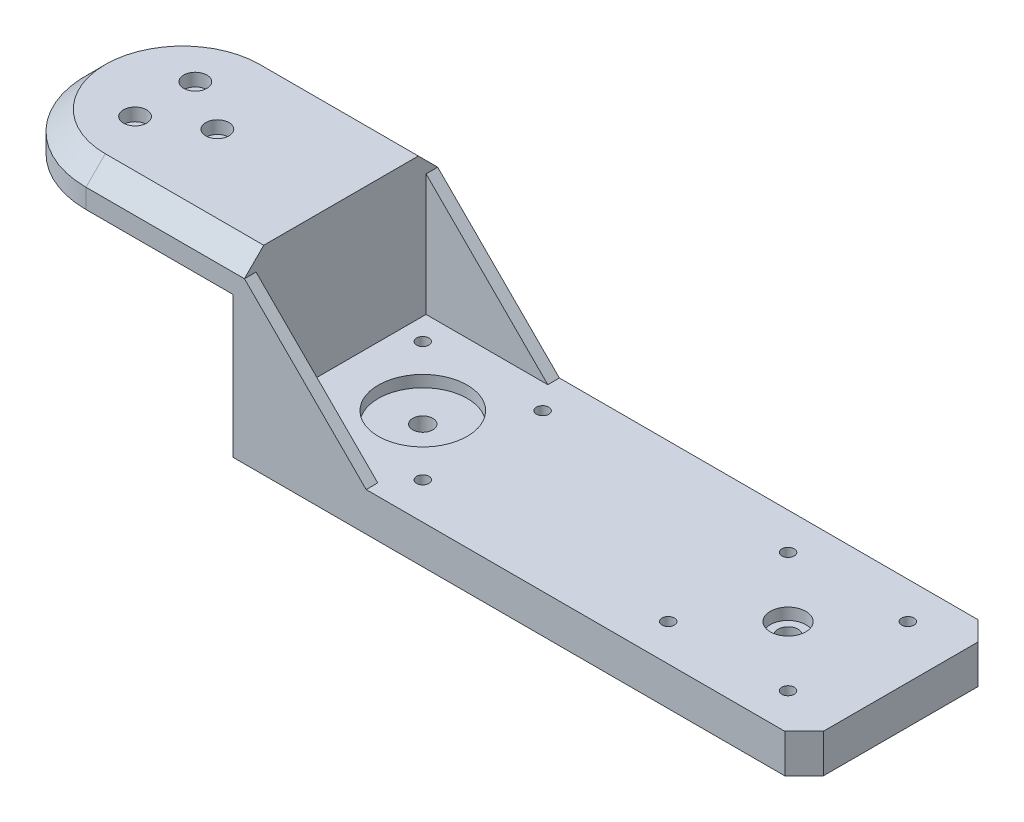
from build123d import *

# Parameters (mm, degrees)
SKETCH_1_R          = 12.4
SKETCH_1_R_2        = 1.6
EXTRUDE_1_DEPTH     = 19.5
EXTRUDE_START       = -10
SKETCH_4_R          = 12.4
EXTRUDE_3_DEPTH     = 10
SKETCH_5_W          = 50
SKETCH_5_H          = 36.5
EXTRUDE_4_DEPTH     = 8
SKETCH_6_W          = 152.81
SKETCH_6_H          = 50
SKETCH_6_R          = 2.6
SKETCH_6_R_2        = 1.6
EXTRUDE_5_DEPTH     = 10
SKETCH_7_R          = 4.6
CUT_EXTRUDE_1_DEPTH = 3
CHAMFER_2_SIZE      = 5
EXTRUDE_6_DEPTH     = 3
EXTRUDE_7_DEPTH     = 3
CHAMFER_3_SIZE      = 5
CHAMFER_4_SIZE      = 5
SKETCH_13_R         = 11.5
CUT_EXTRUDE_3_DEPTH = 3
CHAMFER_6_SIZE      = 1
SKETCH_18_R         = 3
CUT_EXTRUDE_6_DEPTH = 3.3


with BuildPart() as part:
    # 草图1 → 凸台-拉伸1 (new body)
    with BuildSketch(Plane(origin=(0, 0, 0), x_dir=(1, 0, 0), z_dir=(0, 1, 0))):
        Circle(SKETCH_1_R)
        with Locations((9, 0)):
            Circle(SKETCH_1_R_2, mode=Mode.SUBTRACT)
        with Locations((-4.5, -7.794228634)):
            Circle(SKETCH_1_R_2, mode=Mode.SUBTRACT)
        with Locations((-4.5, 7.794228634)):
            Circle(SKETCH_1_R_2, mode=Mode.SUBTRACT)
    extrude(amount=EXTRUDE_1_DEPTH)

    # 草图4 → 凸台-拉伸3 (add)
    with BuildSketch(Plane(origin=(0, 19.5, 0), x_dir=(1, 0, 0), z_dir=(0, 1, 0)).offset(EXTRUDE_START)):
        with BuildLine():
            Line((0, 25), (33, 25))
            Line((33, 25), (33, -25))
            Line((33, -25), (0, -25))
            ThreePointArc((0, -25), (-25, 0), (0, 25))
        make_face()
        Circle(SKETCH_4_R, mode=Mode.SUBTRACT)
    extrude(amount=EXTRUDE_3_DEPTH)

    # 草图5 → 凸台-拉伸4 (add)
    with BuildSketch(Plane(origin=(33, 0, 0), x_dir=(0, 0, -1), z_dir=(1, 0, 0))):
        with Locations((0, 1.25)):
            Rectangle(SKETCH_5_W, SKETCH_5_H)
    extrude(amount=EXTRUDE_4_DEPTH)

    # 草图6 → 凸台-拉伸5 (add)
    with BuildSketch(Plane.XZ.offset(17)):
        with Locations((109.405, 0)):
            Rectangle(SKETCH_6_W, SKETCH_6_H)
        with Locations((62.15, 0)):
            Circle(SKETCH_6_R, mode=Mode.SUBTRACT)
        with Locations((156.66, 0)):
            Circle(SKETCH_6_R, mode=Mode.SUBTRACT)
        with Locations((46.65, 15.5)):
            Circle(SKETCH_6_R_2, mode=Mode.SUBTRACT)
        with Locations((77.65, 15.5)):
            Circle(SKETCH_6_R_2, mode=Mode.SUBTRACT)
        with Locations((77.65, -15.5)):
            Circle(SKETCH_6_R_2, mode=Mode.SUBTRACT)
        with Locations((46.65, -15.5)):
            Circle(SKETCH_6_R_2, mode=Mode.SUBTRACT)
        with Locations((141.16, 15.5)):
            Circle(SKETCH_6_R_2, mode=Mode.SUBTRACT)
        with Locations((172.16, 15.5)):
            Circle(SKETCH_6_R_2, mode=Mode.SUBTRACT)
        with Locations((172.16, -15.5)):
            Circle(SKETCH_6_R_2, mode=Mode.SUBTRACT)
        with Locations((141.16, -15.5)):
            Circle(SKETCH_6_R_2, mode=Mode.SUBTRACT)
    extrude(amount=EXTRUDE_5_DEPTH)

    # 草图7 → 切除-拉伸1 (cut)
    with BuildSketch(Plane(origin=(0, -17, 0), x_dir=(1, 0, 0), z_dir=(0, 1, 0))):
        with Locations((156.66, 0)):
            Circle(SKETCH_7_R)
    extrude(amount=-CUT_EXTRUDE_1_DEPTH, mode=Mode.SUBTRACT)

    # 倒角2
    chamfer_2_edges = [part.edges().sort_by_distance(p)[0] for p in [
        (20.5, 19.5, -25),
        (20.5, 19.5, 25),
        (-25, 19.5, 0),
    ]]
    chamfer(chamfer_2_edges, length=CHAMFER_2_SIZE)

    # 草图9 → 凸台-拉伸6 (add)
    with BuildSketch(Plane.XY.offset(25)):
        Polygon((41, 14.5), (72.5, -17), (41, -17), align=None)
    extrude(amount=-EXTRUDE_6_DEPTH)

    # 草图10 → 凸台-拉伸7 (add)
    with BuildSketch(Plane(origin=(0, 0, -25), x_dir=(-1, 0, 0), z_dir=(0, 0, -1))):
        Polygon((-41, -17), (-41, 14.5), (-72.5, -17), align=None)
    extrude(amount=-EXTRUDE_7_DEPTH)

    # 倒角3
    chamfer_3_edges = [part.edges().sort_by_distance(p)[0] for p in [
        (33, -8.75, 25),
        (33, -8.75, -25),
    ]]
    chamfer(chamfer_3_edges, length=CHAMFER_3_SIZE)

    # 倒角4
    chamfer_4_edges = [part.edges().sort_by_distance(p)[0] for p in [
        (185.81, -22, 25),
        (185.81, -22, -25),
    ]]
    chamfer(chamfer_4_edges, length=CHAMFER_4_SIZE)

    # 草图13 → 切除-拉伸3 (cut)
    with BuildSketch(Plane(origin=(0, -17, 0), x_dir=(1, 0, 0), z_dir=(0, 1, 0))):
        with Locations((62.15, 0)):
            Circle(SKETCH_13_R)
    extrude(amount=-CUT_EXTRUDE_3_DEPTH, mode=Mode.SUBTRACT)

    # 倒角6
    chamfer_6_edges = [part.edges().sort_by_distance(p)[0] for p in [
        (-12.4, 0, 0),
    ]]
    chamfer(chamfer_6_edges, length=CHAMFER_6_SIZE)

    # 草图18 → 切除-拉伸6 (cut)
    with BuildSketch(Plane(origin=(0, 19.5, 0), x_dir=(1, 0, 0), z_dir=(0, 1, 0))):
        with Locations((-4.5, 7.794228634)):
            Circle(SKETCH_18_R)
        with Locations((-4.5, -7.794228634)):
            Circle(SKETCH_18_R)
        with Locations((9, 0)):
            Circle(SKETCH_18_R)
    extrude(amount=-CUT_EXTRUDE_6_DEPTH, mode=Mode.SUBTRACT)


solid = part.part
